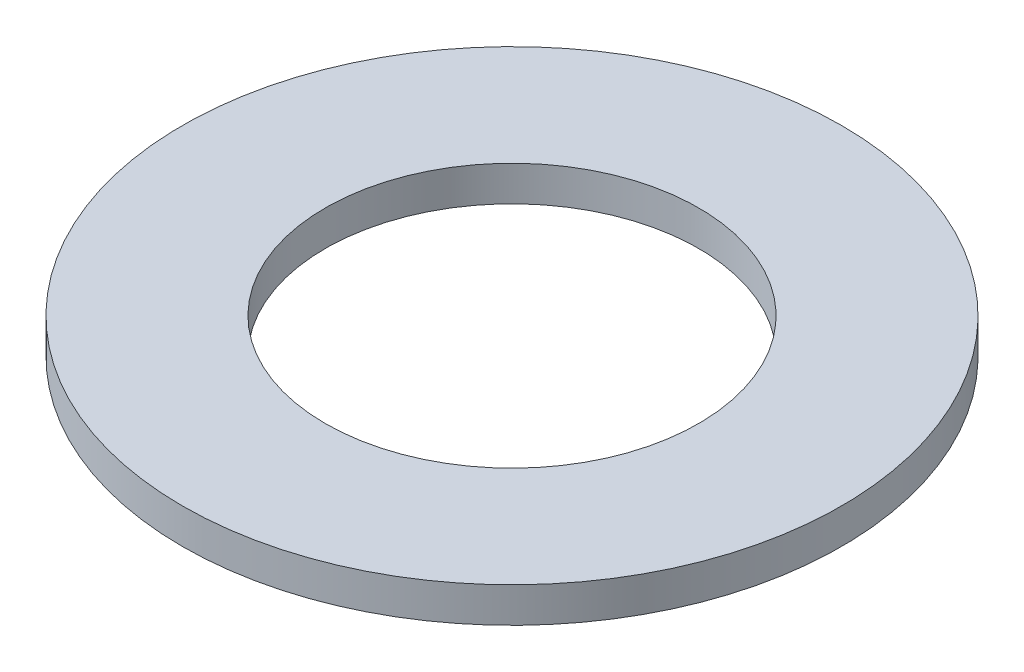
from build123d import *

# Parameters (mm, degrees)
SKETCH1_R           = 75
BOSS_EXTRUDE1_DEPTH = 8
SKETCH2_R           = 42.5
CUT_EXTRUDE1_DEPTH  = 107.367288205


with BuildPart() as part:
    # Sketch1 → Boss-Extrude1 (new body)
    with BuildSketch(Plane(origin=(0, 0, 0), x_dir=(1, 0, 0), z_dir=(0, 1, 0))):
        Circle(SKETCH1_R)
    extrude(amount=BOSS_EXTRUDE1_DEPTH)

    # Sketch2 → Cut-Extrude1 (cut, through all)
    with BuildSketch(Plane(origin=(0, 0, 0), x_dir=(1, 0, 0), z_dir=(0, 1, 0))):
        Circle(SKETCH2_R)
    extrude(amount=CUT_EXTRUDE1_DEPTH, mode=Mode.SUBTRACT)


solid = part.part
